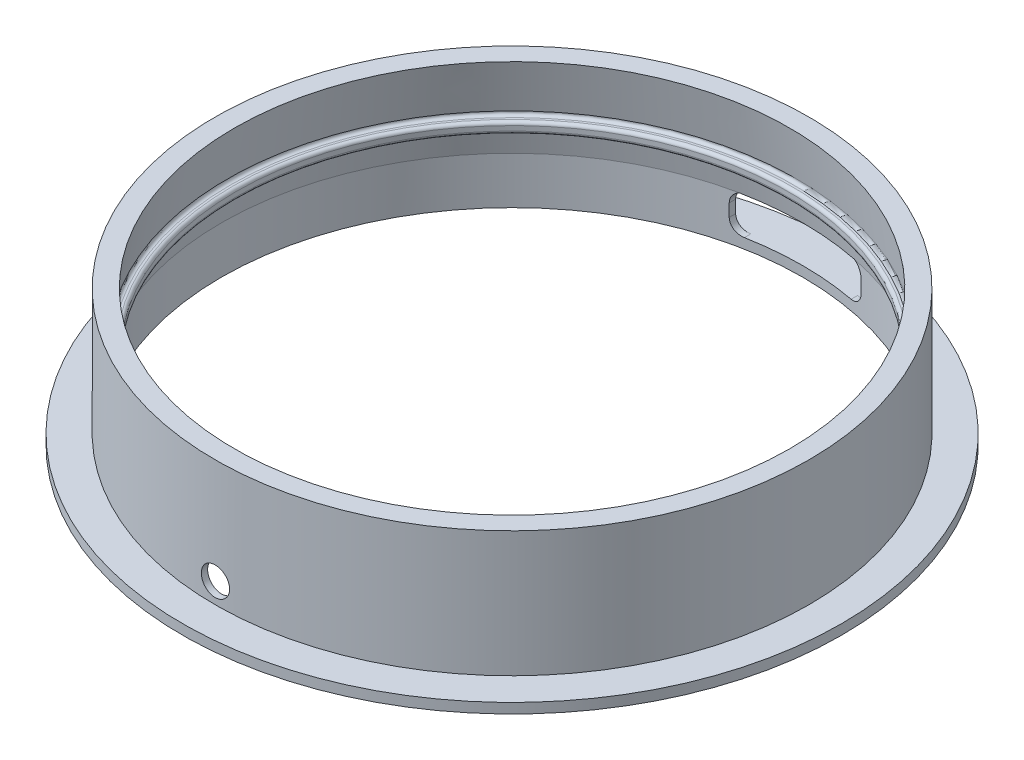
from build123d import *

# Parameters (mm, degrees)
CUT_EXTRUDE1_REACH = 79.324
SKETCH4_W          = 21
SKETCH4_H          = 6
FILLET1_R          = 2
CUT_EXTRUDE2_REACH = 79.324
SKETCH5_R          = 2.25
FILLET2_R          = 0.5


with BuildPart() as part:
    # Sketch2 → Revolve1 (revolve)
    with BuildSketch(Plane.XY):
        Polygon((46.3, 0), (46.3, 21.6), (47.3, 21.6), (47.3, 1.6), (52.5, 1.6), (52.5, 0), align=None)
    revolve(axis=Axis((0, -1000, 0), (0, 1, 0)))

    # Sketch4 → Cut-Extrude1 (cut, up to next)
    with BuildSketch(Plane.XY, mode=Mode.PRIVATE) as cut_extrude1_sk1:
        with Locations((0, 4.6)):
            Rectangle(SKETCH4_W, SKETCH4_H)
    cut_extrude1_tool1 = extrude(cut_extrude1_sk1.sketch, amount=-CUT_EXTRUDE1_REACH, mode=Mode.PRIVATE) & part.part
    add(cut_extrude1_tool1.solids().sort_by_distance((0, 4.6, 0))[0], mode=Mode.SUBTRACT)

    # Fillet1
    fillet1_edges = [part.edges().sort_by_distance(p)[0] for p in [
        (10.5, 1.6, -45.606762076),
        (10.5, 7.6, -45.606762076),
        (-10.5, 7.6, -45.606762076),
        (-10.5, 1.6, -45.606762076),
    ]]
    fillet(fillet1_edges, radius=FILLET1_R)

    # Sketch5 → Cut-Extrude2 (cut, up to next)
    with BuildSketch(Plane.XY, mode=Mode.PRIVATE) as cut_extrude2_sk1:
        with Locations((0, 4.85)):
            Circle(SKETCH5_R)
    cut_extrude2_tool1 = extrude(cut_extrude2_sk1.sketch, amount=CUT_EXTRUDE2_REACH, mode=Mode.PRIVATE) & part.part
    add(cut_extrude2_tool1.solids().sort_by_distance((0, 4.85, 0))[0], mode=Mode.SUBTRACT)

    # Sketch6 → Revolve2 (revolve)
    with BuildSketch(Plane.XY):
        Polygon((-44.243032454, 21.6), (-46.3, 21.6), (-46.3, 7.5), (-45.687286263, 11.7), (-44, 11.7), (-44, 13.45), (-45.431988872, 13.45), align=None)
    revolve(axis=Axis((0, -1000, 0), (0, 1, 0)))

    # Fillet2
    fillet2_edges = [part.edges().sort_by_distance(p)[0] for p in [
        (45.687286263, 11.7, 0),
        (44, 11.7, 0),
        (45.431988872, 13.45, 0),
        (44, 13.45, 0),
    ]]
    fillet(fillet2_edges, radius=FILLET2_R)


solid = part.part
